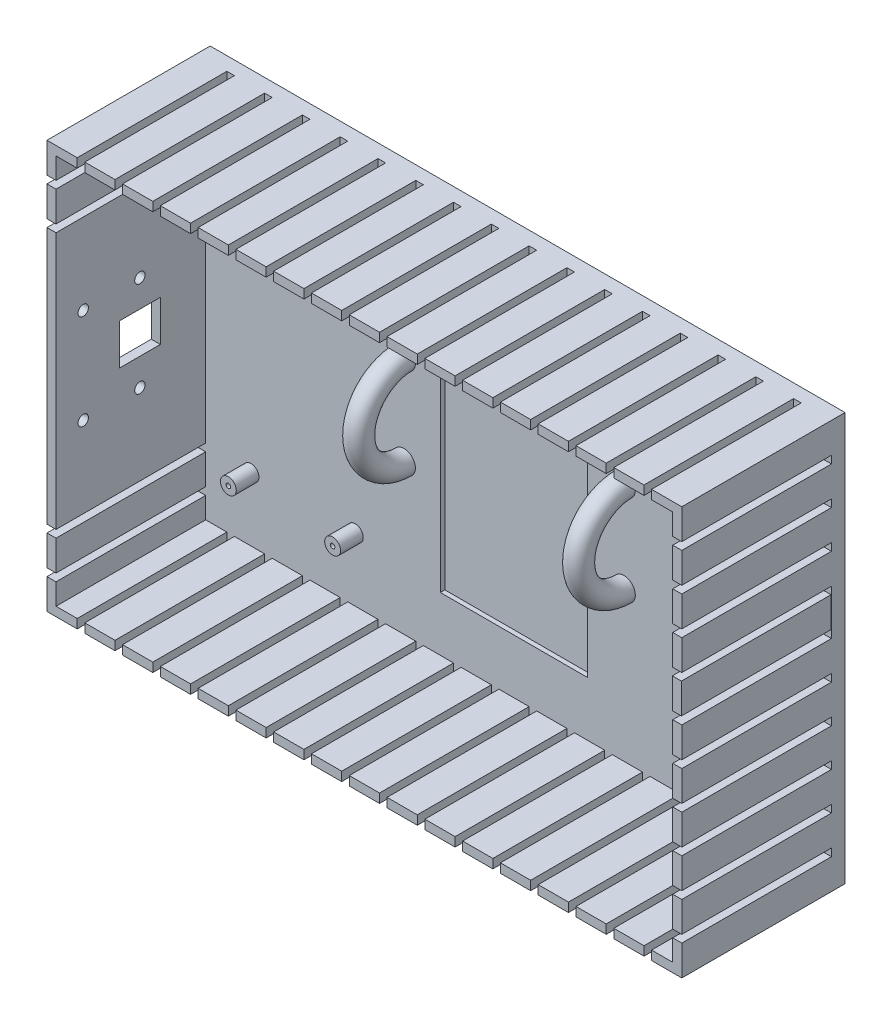
from build123d import *

# Parameters (mm, degrees)
SKETCH1_W           = 90
SKETCH1_H           = 140
BOSS_EXTRUDE1_DEPTH = 3
SKETCH2_W           = 32.5
SKETCH2_H           = 62
CUT_EXTRUDE1_DEPTH  = 1
SKETCH6_R           = 1.75
SKETCH6_R_2         = 0.5
BOSS_EXTRUDE2_DEPTH = 5
SKETCH6_3_R         = 0.5
BOSS_EXTRUDE3_DEPTH = 4
SKETCH7_W           = 6.666666667
SKETCH7_H           = 2
SKETCH7_W_2         = 6.666666666
SKETCH7_W_3         = 2
SKETCH7_H_2         = 6.666666667
SKETCH7_H_3         = 56.666666666
SKETCH7_H_4         = 6.666666666
BOSS_EXTRUDE6_DEPTH = 33
SKETCH9_R           = 2.5
REVOLVE3_ANGLE      = 180
SKETCH11_W          = 9
SKETCH11_H          = 9
SKETCH11_R          = 1.15
CUT_EXTRUDE2_DEPTH  = 150.549322967


with BuildPart() as part:
    # Sketch1 → Boss-Extrude1 (new body)
    with BuildSketch(Plane(origin=(0, 0, 0), x_dir=(0, 1, 0), z_dir=(0, 0, 1))):
        Rectangle(SKETCH1_W, SKETCH1_H)
    extrude(amount=BOSS_EXTRUDE1_DEPTH)

    # Sketch2 → Cut-Extrude1 (cut)
    with BuildSketch(Plane.XY.offset(3)):
        Rectangle(SKETCH2_W, SKETCH2_H)
    extrude(amount=-CUT_EXTRUDE1_DEPTH, mode=Mode.SUBTRACT)

    # Sketch6 → Boss-Extrude2 (add)
    # profile 1 of 4: a face of its own
    with BuildSketch(Plane.XY.offset(3)):
        with Locations((-58, 29)):
            Circle(SKETCH6_R)
        with Locations((-58, 29)):
            Circle(SKETCH6_R_2, mode=Mode.SUBTRACT)
    # profile 2 of 4: a face of its own
    with BuildSketch(Plane.XY.offset(3)):
        with Locations((-35, 29)):
            Circle(SKETCH6_R)
        with Locations((-35, 29)):
            Circle(SKETCH6_R_2, mode=Mode.SUBTRACT)
    # profile 3 of 4: a face of its own
    with BuildSketch(Plane.XY.offset(3)):
        with Locations((-35, -29)):
            Circle(SKETCH6_R)
        with Locations((-35, -29)):
            Circle(SKETCH6_R_2, mode=Mode.SUBTRACT)
    # profile 4 of 4: a face of its own
    with BuildSketch(Plane.XY.offset(3)):
        with Locations((-58, -29)):
            Circle(SKETCH6_R)
        with Locations((-58, -29)):
            Circle(SKETCH6_R_2, mode=Mode.SUBTRACT)
    extrude(amount=BOSS_EXTRUDE2_DEPTH)

    # Sketch6<3> → Boss-Extrude3 (add)
    with BuildSketch(Plane.XY.offset(3)):
        with Locations((-58, 29)):
            Circle(SKETCH6_3_R)
        with Locations((-35, 29)):
            Circle(SKETCH6_3_R)
        with Locations((-58, -29)):
            Circle(SKETCH6_3_R)
        with Locations((-35, -29)):
            Circle(SKETCH6_3_R)
    extrude(amount=BOSS_EXTRUDE3_DEPTH)

    # Sketch7 → Boss-Extrude6 (add)
    with BuildSketch(Plane.XY.offset(3)):
        with Locations((-58.333333334, 44)):
            Rectangle(SKETCH7_W, SKETCH7_H)
        Polygon((-63.333333333, 43), (-63.333333333, 45), (-70, 45), (-70, 38.333333333), (-68, 38.333333333), (-68, 43), align=None)
        with Locations((-50, 44)):
            Rectangle(SKETCH7_W_2, SKETCH7_H)
        with Locations((-41.666666667, 44)):
            Rectangle(SKETCH7_W, SKETCH7_H)
        with Locations((-33.333333334, 44)):
            Rectangle(SKETCH7_W, SKETCH7_H)
        with Locations((-69, 33.333333334)):
            Rectangle(SKETCH7_W_3, SKETCH7_H_2)
        with Locations((-25, 44)):
            Rectangle(SKETCH7_W_2, SKETCH7_H)
        with Locations((-69, 0)):
            Rectangle(SKETCH7_W_3, SKETCH7_H_3)
        with Locations((-16.666666666, 44)):
            Rectangle(SKETCH7_W, SKETCH7_H)
        with Locations((-69, -33.333333334)):
            Rectangle(SKETCH7_W_3, SKETCH7_H_2)
        with Locations((-8.333333334, 44)):
            Rectangle(SKETCH7_W, SKETCH7_H)
        Polygon((-68, -38.333333333), (-70, -38.333333333), (-70, -45), (-63.333333333, -45), (-63.333333333, -43), (-68, -43), align=None)
        with Locations((0, 44)):
            Rectangle(SKETCH7_W_2, SKETCH7_H)
        with Locations((8.333333334, 44)):
            Rectangle(SKETCH7_W, SKETCH7_H)
        with Locations((-58.333333334, -44)):
            Rectangle(SKETCH7_W, SKETCH7_H)
        with Locations((16.666666666, 44)):
            Rectangle(SKETCH7_W, SKETCH7_H)
        with Locations((-50, -44)):
            Rectangle(SKETCH7_W_2, SKETCH7_H)
        with Locations((25, 44)):
            Rectangle(SKETCH7_W_2, SKETCH7_H)
        with Locations((-41.666666667, -44)):
            Rectangle(SKETCH7_W, SKETCH7_H)
        with Locations((33.333333334, 44)):
            Rectangle(SKETCH7_W, SKETCH7_H)
        with Locations((-33.333333334, -44)):
            Rectangle(SKETCH7_W, SKETCH7_H)
        with Locations((41.666666667, 44)):
            Rectangle(SKETCH7_W, SKETCH7_H)
        with Locations((-25, -44)):
            Rectangle(SKETCH7_W_2, SKETCH7_H)
        with Locations((50, 44)):
            Rectangle(SKETCH7_W_2, SKETCH7_H)
        with Locations((-16.666666666, -44)):
            Rectangle(SKETCH7_W, SKETCH7_H)
        with Locations((58.333333334, 44)):
            Rectangle(SKETCH7_W, SKETCH7_H)
        with Locations((-8.333333334, -44)):
            Rectangle(SKETCH7_W, SKETCH7_H)
        Polygon((63.333333333, 45), (63.333333333, 43), (68, 43), (68, 38.333333333), (70, 38.333333333), (70, 45), align=None)
        with Locations((0, -44)):
            Rectangle(SKETCH7_W_2, SKETCH7_H)
        with Locations((8.333333334, -44)):
            Rectangle(SKETCH7_W, SKETCH7_H)
        with Locations((69, 33.333333334)):
            Rectangle(SKETCH7_W_3, SKETCH7_H_2)
        with Locations((16.666666666, -44)):
            Rectangle(SKETCH7_W, SKETCH7_H)
        with Locations((69, 25)):
            Rectangle(SKETCH7_W_3, SKETCH7_H_4)
        with Locations((25, -44)):
            Rectangle(SKETCH7_W_2, SKETCH7_H)
        with Locations((69, 16.666666666)):
            Rectangle(SKETCH7_W_3, SKETCH7_H_2)
        with Locations((33.333333334, -44)):
            Rectangle(SKETCH7_W, SKETCH7_H)
        with Locations((69, 0)):
            Rectangle(SKETCH7_W_3, SKETCH7_H_4)
        with Locations((41.666666667, -44)):
            Rectangle(SKETCH7_W, SKETCH7_H)
        with Locations((69, -8.333333334)):
            Rectangle(SKETCH7_W_3, SKETCH7_H_2)
        with Locations((50, -44)):
            Rectangle(SKETCH7_W_2, SKETCH7_H)
        with Locations((69, -16.666666666)):
            Rectangle(SKETCH7_W_3, SKETCH7_H_2)
        with Locations((58.333333334, -44)):
            Rectangle(SKETCH7_W, SKETCH7_H)
        with Locations((69, -25)):
            Rectangle(SKETCH7_W_3, SKETCH7_H_4)
        Polygon((63.333333333, -43), (63.333333333, -45), (70, -45), (70, -38.333333333), (68, -38.333333333), (68, -43), align=None)
        with Locations((69, -33.333333334)):
            Rectangle(SKETCH7_W_3, SKETCH7_H_2)
        with Locations((68.917454657, 8.333333334)):
            Rectangle(SKETCH7_W_3, SKETCH7_H_2)
    extrude(amount=BOSS_EXTRUDE6_DEPTH)

    # Sketch9 → Revolve3 (revolve)
    with BuildSketch(Plane.XY.offset(3)):
        with Locations((-24.25, -10)):
            Circle(SKETCH9_R)
        with Locations((24.25, -10)):
            Circle(SKETCH9_R)
    revolve(axis=Axis((-36.309330937, 0, 3), (-1, 0, 0)), revolution_arc=REVOLVE3_ANGLE)

    # Sketch11 → Cut-Extrude2 (cut, through all)
    with BuildSketch(Plane.YZ.offset(-68)):
        with Locations((0, 17.5)):
            Rectangle(SKETCH11_W, SKETCH11_H)
        with Locations((-10.5, 30)):
            Circle(SKETCH11_R)
        with Locations((10.5, 30)):
            Circle(SKETCH11_R)
        with Locations((10.5, 17.5)):
            Circle(SKETCH11_R)
        with Locations((-10.5, 17.5)):
            Circle(SKETCH11_R)
    extrude(amount=-CUT_EXTRUDE2_DEPTH, mode=Mode.SUBTRACT)


solid = part.part
